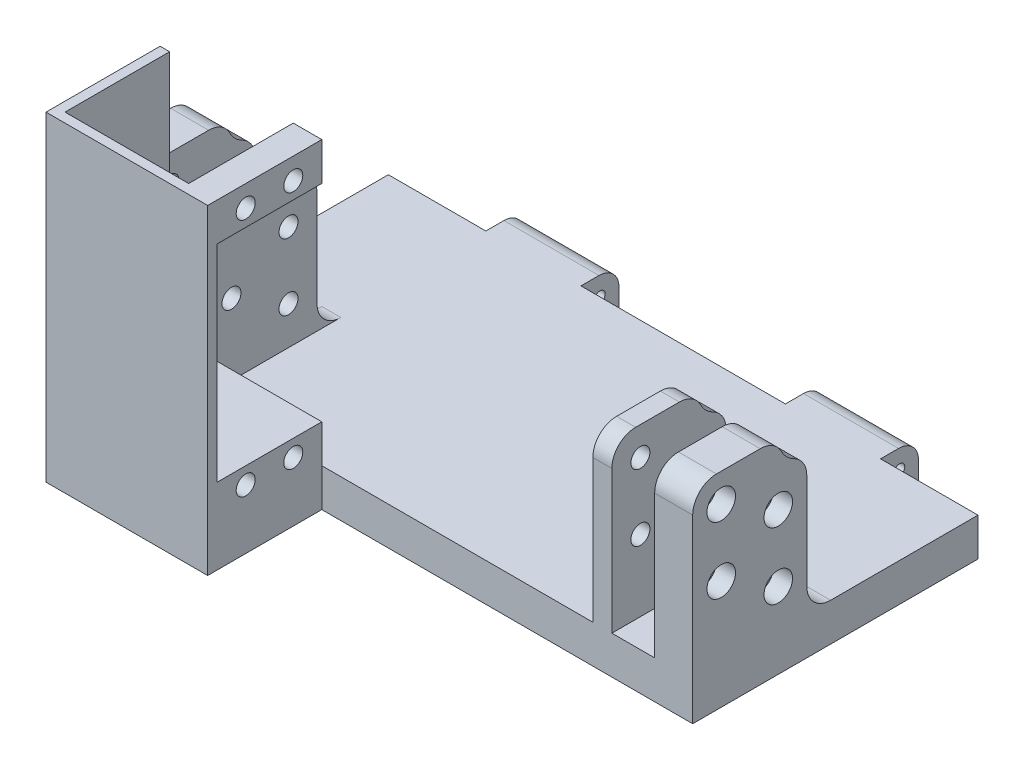
from build123d import *

# Parameters (mm, degrees)
ESQUISSE1_W             = 124
ESQUISSE1_H             = 60
BOSS_EXTRU_1_DEPTH      = 8
ESQUISSE2_R             = 1.1
BOSS_EXTRU_2_DEPTH      = 20
ESQUISSE3_R             = 2
BOSS_EXTRU_3_DEPTH      = 21
CONG_1_R                = 5
ESQUISSE4_R             = 3
ENL_V_MAT_EXTRU_1_DEPTH = 4
ENL_V_MAT_EXTRU_2_REACH = 149.814
ESQUISSE5_W             = 9
ESQUISSE5_H             = 29
SYM_TRIE3_START         = 116
SYM_TRIE3_OUTLINE_R     = 3
SYM_TRIE3_DEPTH         = 8
SYM_TRIE3_START_2       = 103
SYM_TRIE3_2_OUTLINE_R   = 2
SYM_TRIE3_2_DEPTH       = 4
SYM_TRIE3_3_OUTLINE_R   = 3
SYM_TRIE3_3_OUTLINE_R_2 = 2
SYM_TRIE3_3_DEPTH       = 4
ESQUISSE8_W             = 34
ESQUISSE8_H             = 24
BOSS_EXTRU_4_DEPTH      = 59.4
ESQUISSE9_W             = 26
ESQUISSE9_H             = 22
ENL_V_MAT_EXTRU_4_DEPTH = 51.4
ESQUISSE10_R            = 2
ESQUISSE10_W            = 22
ESQUISSE10_H            = 43.4
ENL_V_MAT_EXTRU_5_DEPTH = 25
ESQUISSE13_W            = 34
ESQUISSE13_H            = 24
BOSS_EXTRU_6_DEPTH      = 8


# Read off the part's stored shape, not the designer's step: Symétrie3
with BuildPart() as part:
    # Esquisse1 → Boss.-Extru.1 (new body)
    with BuildSketch(Plane(origin=(0, 0, 0), x_dir=(1, 0, 0), z_dir=(0, 1, 0))):
        with Locations((62, 30)):
            Rectangle(ESQUISSE1_W, ESQUISSE1_H)
    extrude(amount=BOSS_EXTRU_1_DEPTH)

    # Esquisse2 → Boss.-Extru.2 (add)
    with BuildSketch(Plane.ZY.offset(-20.5)):
        with BuildLine():
            Line((-60, 8), (-63.8, 8))
            ThreePointArc((-63.8, 8), (-66.769848481, 6.769848481), (-68, 3.8))
            Line((-68, 3.8), (-68, 0))
            Line((-68, 0), (-60, 0))
            Line((-60, 0), (-60, 8))
        make_face()
        with Locations((-64, 4)):
            Circle(ESQUISSE2_R, mode=Mode.SUBTRACT)
    boss_extru_2 = extrude(amount=-BOSS_EXTRU_2_DEPTH)

    # Symétrie2: Boss.-Extru.2 across plane
    add(boss_extru_2.mirror(Plane.ZY.offset(-62)))

    # Esquisse3 → Boss.-Extru.3 (add)
    with BuildSketch(Plane.ZY):
        with BuildLine():
            Line((0, 8), (-24, 8))
            Line((-24, 8), (-24, 37))
            ThreePointArc((-24, 37), (-19.757359313, 38.757359313), (-18, 43))
            Line((-18, 43), (0, 43))
            Line((0, 43), (0, 8))
        make_face()
        with Locations((-6, 37)):
            Circle(ESQUISSE3_R, mode=Mode.SUBTRACT)
        with Locations((-6, 23)):
            Circle(ESQUISSE3_R, mode=Mode.SUBTRACT)
        with Locations((-18, 30)):
            Circle(ESQUISSE3_R, mode=Mode.SUBTRACT)
        with Locations((-18, 16)):
            Circle(ESQUISSE3_R, mode=Mode.SUBTRACT)
    extrude(amount=-BOSS_EXTRU_3_DEPTH)

    # Congé1
    cong_1_edges = [part.edges().sort_by_distance(p)[0] for p in [
        (10.5, 43, 0),
        (10.5, 8, -24),
        (10.5, 37, -24),
        (10.5, 43, -18),
    ]]
    fillet(cong_1_edges, radius=CONG_1_R)

    # Esquisse4 → Enlèv. mat.-Extru.1 (cut)
    with BuildSketch(Plane.ZY):
        with Locations((-18, 30)):
            Circle(ESQUISSE4_R)
        with Locations((-6, 37)):
            Circle(ESQUISSE4_R)
        with Locations((-6, 23)):
            Circle(ESQUISSE4_R)
        with Locations((-18, 16)):
            Circle(ESQUISSE4_R)
    extrude(amount=-ENL_V_MAT_EXTRU_1_DEPTH, mode=Mode.SUBTRACT)

    # Enlèv. mat.-Extru.2: up to this face of the body (flat: up to its plane)
    enl_v_mat_extru_2_end = Plane(part.part.faces().sort_by_distance((66.491407704, 8, -32.046154948))[0])
    # Esquisse5 → Enlèv. mat.-Extru.2 (cut, up to the picked face)
    with BuildSketch(Plane(origin=(0, 43, 0), x_dir=(1, 0, 0), z_dir=(0, 1, 0)), mode=Mode.PRIVATE) as enl_v_mat_extru_2_sk1:
        with Locations((12.5, 14.5)):
            Rectangle(ESQUISSE5_W, ESQUISSE5_H)
    enl_v_mat_extru_2_tool1 = split(extrude(enl_v_mat_extru_2_sk1.sketch, amount=-ENL_V_MAT_EXTRU_2_REACH, mode=Mode.PRIVATE), bisect_by=enl_v_mat_extru_2_end, keep=Keep.BOTH, mode=Mode.PRIVATE)
    add(enl_v_mat_extru_2_tool1.solids().sort_by(Axis((12.5, 43, -14.5), (0, -1, 0)))[0], mode=Mode.SUBTRACT)

    # Symétrie3 outline → Symétrie3 (add)
    with BuildSketch(Plane.YZ.offset(SYM_TRIE3_START)):
        with BuildLine():
            Line((38, 0), (8, 0))
            Line((8, 0), (8, -29))
            ThreePointArc((8, -29), (9.464466094, -25.464466094), (13, -24))
            Line((13, -24), (33.202041029, -24))
            ThreePointArc((33.202041029, -24), (35.813205868, -23.264014327), (37.655658743, -21.272727273))
            ThreePointArc((37.655658743, -21.272727273), (38.757359313, -19.757359313), (40.272727273, -18.655658743))
            ThreePointArc((40.272727273, -18.655658743), (42.264014327, -16.813205868), (43, -14.202041029))
            Line((43, -14.202041029), (43, -5))
            ThreePointArc((43, -5), (41.535533906, -1.464466094), (38, 0))
        make_face()
        with Locations((16, -18)):
            Circle(SYM_TRIE3_OUTLINE_R, mode=Mode.SUBTRACT)
        with Locations((30, -18)):
            Circle(SYM_TRIE3_OUTLINE_R, mode=Mode.SUBTRACT)
        with Locations((23, -6)):
            Circle(SYM_TRIE3_OUTLINE_R, mode=Mode.SUBTRACT)
        with Locations((37, -6)):
            Circle(SYM_TRIE3_OUTLINE_R, mode=Mode.SUBTRACT)
    extrude(amount=SYM_TRIE3_DEPTH)

    # Sym_trie3 2 outline → Sym_trie3 2 (add)
    with BuildSketch(Plane.YZ.offset(SYM_TRIE3_START_2)):
        with BuildLine():
            Line((38, 0), (8, 0))
            Line((8, 0), (8, -29))
            ThreePointArc((8, -29), (9.464466094, -25.464466094), (13, -24))
            Line((13, -24), (33.202041029, -24))
            ThreePointArc((33.202041029, -24), (35.813205868, -23.264014327), (37.655658743, -21.272727273))
            ThreePointArc((37.655658743, -21.272727273), (38.757359313, -19.757359313), (40.272727273, -18.655658743))
            ThreePointArc((40.272727273, -18.655658743), (42.264014327, -16.813205868), (43, -14.202041029))
            Line((43, -14.202041029), (43, -5))
            ThreePointArc((43, -5), (41.535533906, -1.464466094), (38, 0))
        make_face()
        with Locations((16, -18)):
            Circle(SYM_TRIE3_2_OUTLINE_R, mode=Mode.SUBTRACT)
        with Locations((30, -18)):
            Circle(SYM_TRIE3_2_OUTLINE_R, mode=Mode.SUBTRACT)
        with Locations((23, -6)):
            Circle(SYM_TRIE3_2_OUTLINE_R, mode=Mode.SUBTRACT)
        with Locations((37, -6)):
            Circle(SYM_TRIE3_2_OUTLINE_R, mode=Mode.SUBTRACT)
    extrude(amount=SYM_TRIE3_2_DEPTH)

    # Sym_trie3 3 outline → Sym_trie3 3 (add)
    # profile 1 of 4: a face of its own
    with BuildSketch(Plane.YZ.offset(SYM_TRIE3_START)):
        with Locations((16, -18)):
            Circle(SYM_TRIE3_3_OUTLINE_R)
        with Locations((16, -18)):
            Circle(SYM_TRIE3_3_OUTLINE_R_2, mode=Mode.SUBTRACT)
    # profile 2 of 4: a face of its own
    with BuildSketch(Plane.YZ.offset(SYM_TRIE3_START)):
        with Locations((30, -18)):
            Circle(SYM_TRIE3_3_OUTLINE_R)
        with Locations((30, -18)):
            Circle(SYM_TRIE3_3_OUTLINE_R_2, mode=Mode.SUBTRACT)
    # profile 3 of 4: a face of its own
    with BuildSketch(Plane.YZ.offset(SYM_TRIE3_START)):
        with Locations((23, -6)):
            Circle(SYM_TRIE3_3_OUTLINE_R)
        with Locations((23, -6)):
            Circle(SYM_TRIE3_3_OUTLINE_R_2, mode=Mode.SUBTRACT)
    # profile 4 of 4: a face of its own
    with BuildSketch(Plane.YZ.offset(SYM_TRIE3_START)):
        with Locations((37, -6)):
            Circle(SYM_TRIE3_3_OUTLINE_R)
        with Locations((37, -6)):
            Circle(SYM_TRIE3_3_OUTLINE_R_2, mode=Mode.SUBTRACT)
    extrude(amount=SYM_TRIE3_3_DEPTH)



with BuildPart() as body_2:
    # Esquisse8 → Boss.-Extru.4 (new body)
    with BuildSketch(Plane(origin=(0, 8, 0), x_dir=(1, 0, 0), z_dir=(0, 1, 0))):
        with Locations((29, -12)):
            Rectangle(ESQUISSE8_W, ESQUISSE8_H)
    extrude(amount=BOSS_EXTRU_4_DEPTH)

    # Esquisse9 → Enlèv. mat.-Extru.4 (cut)
    with BuildSketch(Plane(origin=(0, 67.4, 0), x_dir=(1, 0, 0), z_dir=(0, 1, 0))):
        with Locations((27, -11)):
            Rectangle(ESQUISSE9_W, ESQUISSE9_H)
    extrude(amount=-ENL_V_MAT_EXTRU_4_DEPTH, mode=Mode.SUBTRACT)

    # Esquisse10 → Enlèv. mat.-Extru.5 (cut)
    with BuildSketch(Plane(origin=(46, 0, 0), x_dir=(0, 0, -1), z_dir=(1, 0, 0))):
        with Locations((-16, 12.5)):
            Circle(ESQUISSE10_R)
        with Locations((-6, 12.5)):
            Circle(ESQUISSE10_R)
        with Locations((-16, 62.9)):
            Circle(ESQUISSE10_R)
        with Locations((-6, 62.9)):
            Circle(ESQUISSE10_R)
        with Locations((-11, 37.7)):
            Rectangle(ESQUISSE10_W, ESQUISSE10_H)
    extrude(amount=-ENL_V_MAT_EXTRU_5_DEPTH, mode=Mode.SUBTRACT)


with BuildPart() as part_1:
    add(part.part)

    add(body_2.part)  # Boss.-Extru.6 merges body 2
    # Esquisse13 → Boss.-Extru.6 (add)
    with BuildSketch(Plane.XZ):
        with Locations((29, 12)):
            Rectangle(ESQUISSE13_W, ESQUISSE13_H)
    extrude(amount=-BOSS_EXTRU_6_DEPTH)


solid = part_1.part
